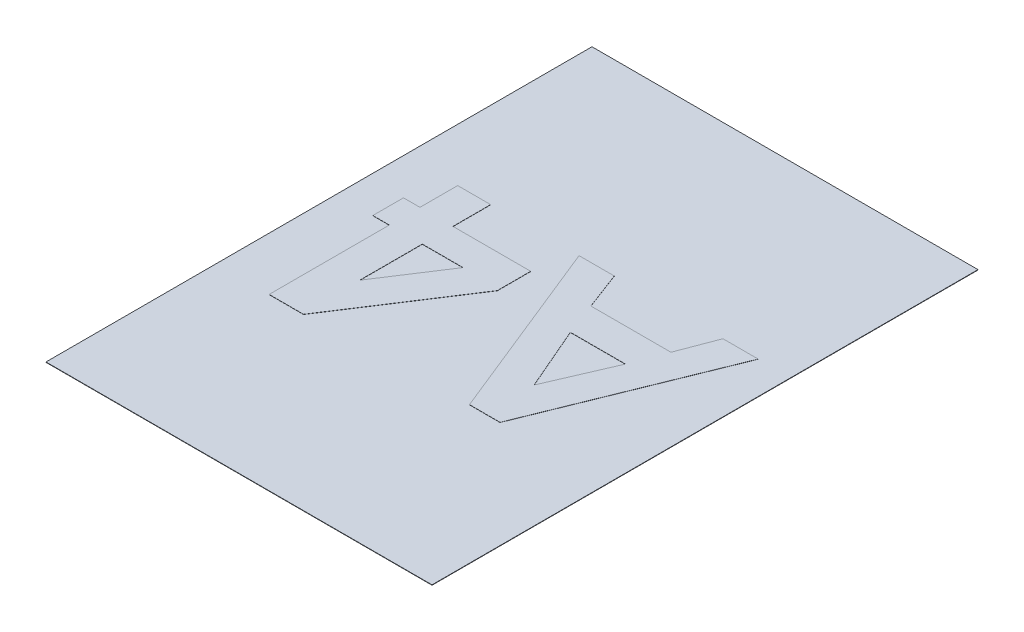
from build123d import *

# Parameters (mm, degrees)
SKETCH1_W      = 210
SKETCH1_H      = 297
EXTRUDE1_DEPTH = 0.2
EXTRUDE2_START = 0.2
EXTRUDE2_DEPTH = 0.1


# Read off the part's stored shape, not the designer's step: Extrude2
with BuildPart() as part:
    # Sketch1 → Extrude1 (new body)
    with BuildSketch(Plane(origin=(0, 0, 0), x_dir=(1, 0, 0), z_dir=(0, 1, 0))):
        with Locations((105, 148.5)):
            Rectangle(SKETCH1_W, SKETCH1_H)
    extrude(amount=EXTRUDE1_DEPTH)

    # Extrude2 outline → Extrude2 (add)
    # profile 1 of 2: a face of its own
    with BuildSketch(Plane(origin=(0, 0, 0), x_dir=(1, 0, 0), z_dir=(0, 1, 0)).offset(EXTRUDE2_START)):
        Polygon((135.38747678, 94.971472029), (152.034111396, 94.971472029), (192.438758831, 194.971472029), (173.288117806, 194.971472029), (165.515681908, 174.458651516), (121.94597037, 174.458651516), (114.173534472, 194.971472029), (95.002861396, 194.971472029), align=None)
        Polygon((158.704784472, 156.509933567), (143.720810113, 121.794388695), (128.736835755, 156.509933567), align=None, mode=Mode.SUBTRACT)
    # profile 2 of 2: a face of its own
    with BuildSketch(Plane(origin=(0, 0, 0), x_dir=(1, 0, 0), z_dir=(0, 1, 0)).offset(EXTRUDE2_START)):
        Polygon((46.925938319, 174.458651516), (46.925938319, 194.971472029), (28.97722037, 194.971472029), (28.97722037, 174.458651516), (20.002861396, 174.458651516), (20.002861396, 157.791984849), (28.97722037, 157.791984849), (28.97722037, 92.407369465), (47.687156267, 92.407369465), (89.233630626, 156.289581003), (89.233630626, 174.458651516), align=None)
        Polygon((69.061354985, 157.791984849), (46.925938319, 123.757529721), (46.925938319, 157.791984849), align=None, mode=Mode.SUBTRACT)
    extrude(amount=EXTRUDE2_DEPTH)


solid = part.part
